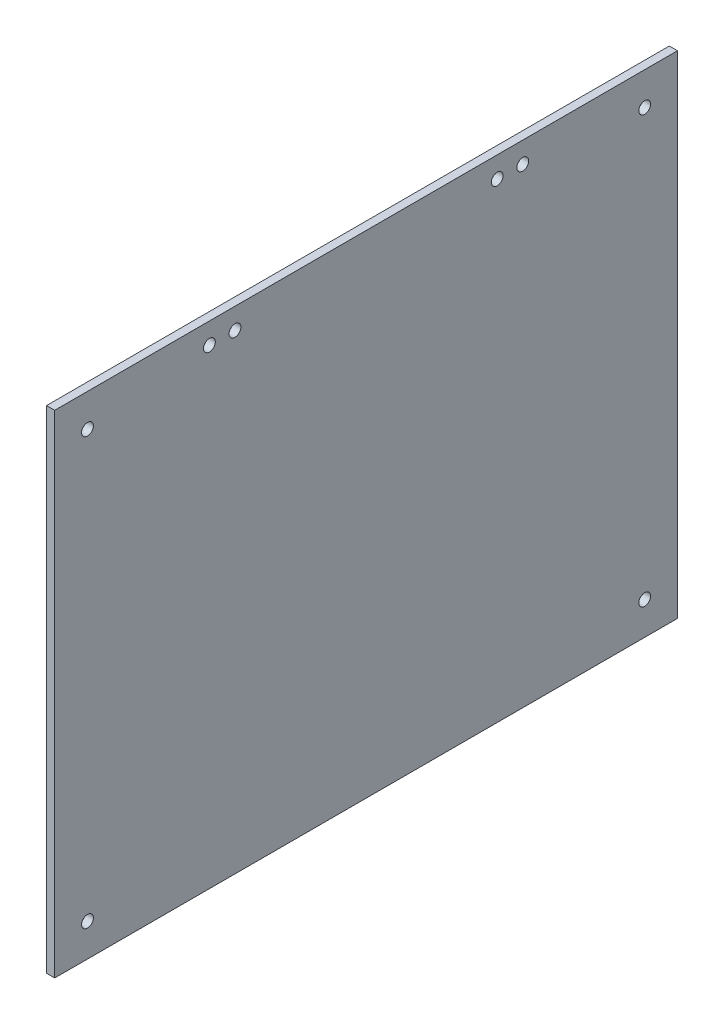
from build123d import *

# Parameters (mm, degrees)
SKETCH1_W           = 241.3
SKETCH1_H           = 190.5
BOSS_EXTRUDE1_DEPTH = 3.175
SKETCH2_R           = 2.286
CUT_EXTRUDE1_DEPTH  = 308.450842616
SKETCH3_R           = 2.286
CUT_EXTRUDE2_DEPTH  = 308.450842616


with BuildPart() as part:
    # Sketch1 → Boss-Extrude1 (new body)
    with BuildSketch(Plane(origin=(0, 0, 0), x_dir=(0, 0, -1), z_dir=(1, 0, 0))):
        with Locations((120.65, 95.25)):
            Rectangle(SKETCH1_W, SKETCH1_H)
    extrude(amount=BOSS_EXTRUDE1_DEPTH)

    # Sketch2 → Cut-Extrude1 (cut, through all)
    with BuildSketch(Plane(origin=(3.175, 0, 0), x_dir=(0, 0, -1), z_dir=(1, 0, 0))):
        with Locations((228.6, 12.7)):
            Circle(SKETCH2_R)
        with Locations((228.6, 177.8)):
            Circle(SKETCH2_R)
        with Locations((12.7, 12.7)):
            Circle(SKETCH2_R)
        with Locations((12.7, 177.8)):
            Circle(SKETCH2_R)
    extrude(amount=-CUT_EXTRUDE1_DEPTH, mode=Mode.SUBTRACT)

    # Sketch3 → Cut-Extrude2 (cut, through all)
    with BuildSketch(Plane(origin=(3.175, 0, 0), x_dir=(0, 0, -1), z_dir=(1, 0, 0))):
        with Locations((59.944, 182.372)):
            Circle(SKETCH3_R)
        with Locations((69.85, 182.372)):
            Circle(SKETCH3_R)
        with Locations((171.45, 182.372)):
            Circle(SKETCH3_R)
        with Locations((181.356, 182.372)):
            Circle(SKETCH3_R)
    extrude(amount=-CUT_EXTRUDE2_DEPTH, mode=Mode.SUBTRACT)


solid = part.part
